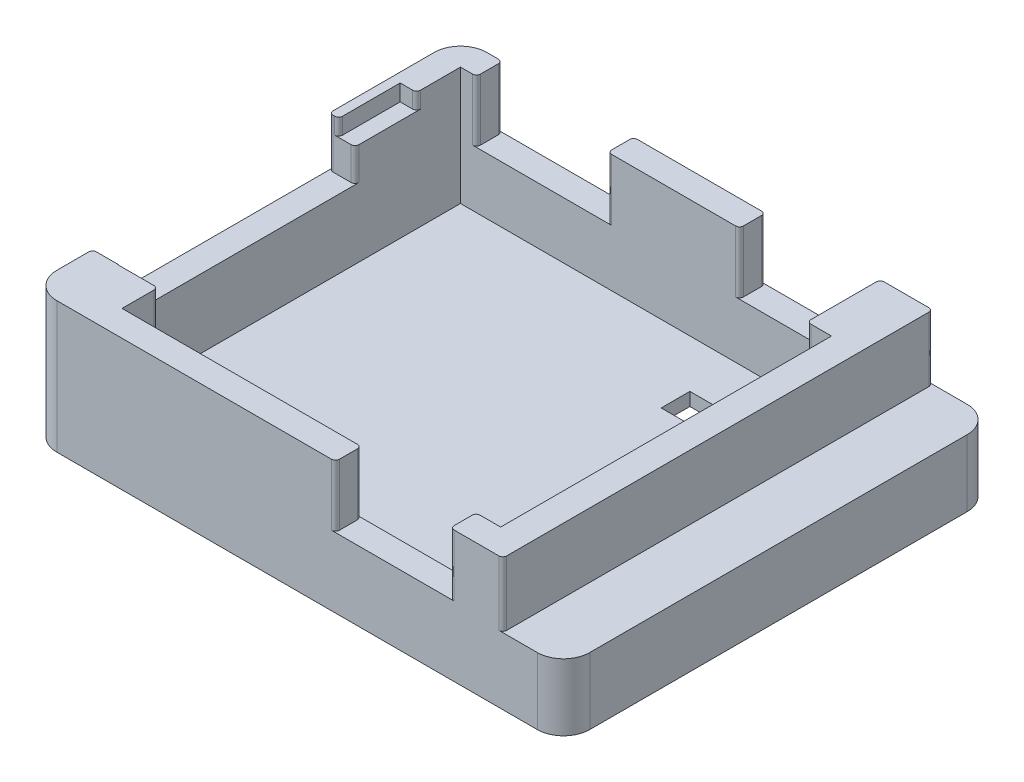
from build123d import *

# Parameters (mm, degrees)
SKETCH1_W           = 103.124
SKETCH1_H           = 83.185
BOSS_EXTRUDE1_DEPTH = 25.4
CUT_EXTRUDE1_DEPTH  = 22.86
SKETCH3_W           = 11.7475
SKETCH3_H           = 83.185
CUT_EXTRUDE2_DEPTH  = 12.4841
SKETCH4_W           = 22.225
SKETCH4_H           = 11.90625
CUT_EXTRUDE3_DEPTH  = 127
SKETCH5_W           = 25.4
SKETCH5_H           = 11.90625
CUT_EXTRUDE4_DEPTH  = 5.08
SKETCH6_W           = 45.7835
SKETCH6_H           = 9.525
CUT_EXTRUDE5_DEPTH  = 5.08
SKETCH7_W           = 3.175
SKETCH7_H           = 11.90625
CUT_EXTRUDE6_DEPTH  = 3.175
SKETCH8_W           = 11.1125
SKETCH8_H           = 5.55625
CUT_EXTRUDE7_DEPTH  = 5.08
FILLET1_R           = 5.08
FILLET2_R           = 0.762


with BuildPart() as part:
    # Sketch1 → Boss-Extrude1 (new body)
    with BuildSketch(Plane(origin=(0, 0, 0), x_dir=(1, 0, 0), z_dir=(0, 1, 0))):
        with Locations((51.562, 41.5925)):
            Rectangle(SKETCH1_W, SKETCH1_H)
    extrude(amount=BOSS_EXTRUDE1_DEPTH)

    # Sketch2 → Cut-Extrude1 (cut)
    with BuildSketch(Plane(origin=(0, 25.4, 0), x_dir=(1, 0, 0), z_dir=(0, 1, 0))):
        Polygon((5, 78.185), (81.2, 78.185), (81.2, 69.0118), (85.9625, 69.0118), (85.9625, 5), (12.7, 5), (12.7, 11.9253), (5, 11.9253), align=None)
    extrude(amount=-CUT_EXTRUDE1_DEPTH, mode=Mode.SUBTRACT)

    # Sketch3 → Cut-Extrude2 (cut)
    with BuildSketch(Plane(origin=(0, 25.4, 0), x_dir=(1, 0, 0), z_dir=(0, 1, 0))):
        with Locations((97.25025, 41.5925)):
            Rectangle(SKETCH3_W, SKETCH3_H)
    extrude(amount=-CUT_EXTRUDE2_DEPTH, mode=Mode.SUBTRACT)

    # Sketch4 → Cut-Extrude3 (cut)
    with BuildSketch(Plane(origin=(0, 0, -83.185), x_dir=(-1, 0, 0), z_dir=(0, 0, -1))):
        with Locations((-70.104, 19.446875)):
            Rectangle(SKETCH4_W, SKETCH4_H)
    extrude(amount=-CUT_EXTRUDE3_DEPTH, mode=Mode.SUBTRACT)

    # Sketch5 → Cut-Extrude4 (cut)
    with BuildSketch(Plane(origin=(0, 0, -83.185), x_dir=(-1, 0, 0), z_dir=(0, 0, -1))):
        with Locations((-20.8026, 19.446875)):
            Rectangle(SKETCH5_W, SKETCH5_H)
    extrude(amount=-CUT_EXTRUDE4_DEPTH, mode=Mode.SUBTRACT)

    # Sketch6 → Cut-Extrude5 (cut)
    with BuildSketch(Plane.ZY):
        with Locations((-34.89325, 20.6375)):
            Rectangle(SKETCH6_W, SKETCH6_H)
    extrude(amount=-CUT_EXTRUDE5_DEPTH, mode=Mode.SUBTRACT)

    # Sketch7 → Cut-Extrude6 (cut)
    with BuildSketch(Plane(origin=(0, 25.4, 0), x_dir=(1, 0, 0), z_dir=(0, 1, 0))):
        with Locations((3.4125, 63.738125)):
            Rectangle(SKETCH7_W, SKETCH7_H)
    extrude(amount=-CUT_EXTRUDE6_DEPTH, mode=Mode.SUBTRACT)

    # Sketch8 → Cut-Extrude7 (cut)
    with BuildSketch(Plane.XZ):
        with Locations((64.23025, -66.119375)):
            Rectangle(SKETCH8_W, SKETCH8_H)
    extrude(amount=-CUT_EXTRUDE7_DEPTH, mode=Mode.SUBTRACT)

    # Fillet1
    fillet1_edges = [part.edges().sort_by_distance(p)[0] for p in [
        (103.124, 6.45795, -83.185),
        (103.124, 6.45795, 0),
        (0, 12.7, 0),
        (0, 12.7, -83.185),
    ]]
    fillet(fillet1_edges, radius=FILLET1_R)

    # Fillet2
    fillet2_edges = [part.edges().sort_by_distance(p)[0] for p in [
        (91.3765, 19.15795, 0),
        (81.2165, 19.446875, 0),
        (81.2165, 19.446875, -5),
        (58.9915, 19.446875, 0),
        (58.9915, 19.446875, -5),
        (12.7, 13.97, -11.9253),
        (0, 20.6375, -12.0015),
        (0, 20.6375, -57.785),
        (91.3765, 19.15795, -83.185),
        (81.2165, 19.446875, -69.0118),
        (81.2165, 19.446875, -83.185),
        (58.9915, 19.446875, -83.185),
        (58.9915, 19.446875, -78.185),
        (33.5026, 19.446875, -78.185),
        (33.5026, 19.446875, -83.185),
        (8.1026, 19.446875, -83.185),
        (8.1026, 19.446875, -78.185),
        (1.825, 23.8125, -57.785),
        (5, 23.8125, -69.69125),
        (5, 19.05, -57.785),
    ]]
    fillet(fillet2_edges, radius=FILLET2_R)


solid = part.part
